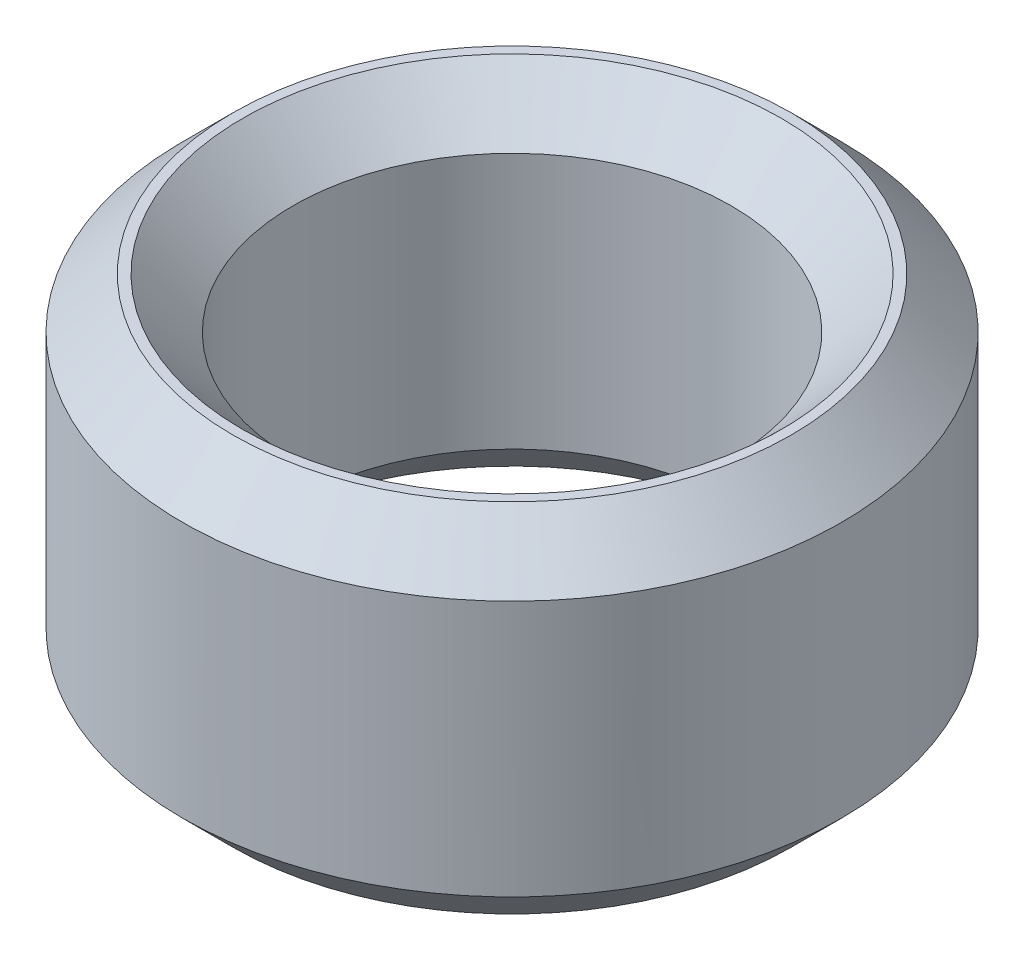
from build123d import *

# Parameters (mm, degrees)
SKETCH1_R           = 20
BOSS_EXTRUDE1_DEPTH = 21.66332573
SKETCH2_R           = 13.291825779
CUT_EXTRUDE1_DEPTH  = 36.627232305
CHAMFER1_SIZE       = 3.060013908


with BuildPart() as part:
    # Sketch1 → Boss-Extrude1 (new body)
    with BuildSketch(Plane(origin=(0, 0, 0), x_dir=(1, 0, 0), z_dir=(0, 1, 0))):
        Circle(SKETCH1_R)
    extrude(amount=BOSS_EXTRUDE1_DEPTH)

    # Sketch2 → Cut-Extrude1 (cut, through all)
    with BuildSketch(Plane(origin=(0, 0, 0), x_dir=(1, 0, 0), z_dir=(0, 1, 0))):
        Circle(SKETCH2_R)
    extrude(amount=CUT_EXTRUDE1_DEPTH, mode=Mode.SUBTRACT)

    # Chamfer1
    chamfer1_edges = [part.edges().sort_by_distance(p)[0] for p in [
        (-13.291825779, 21.66332573, 0),
        (-13.291825779, 0, 0),
        (-20, 0, 0),
        (-20, 21.66332573, 0),
    ]]
    chamfer(chamfer1_edges, length=CHAMFER1_SIZE)


solid = part.part
